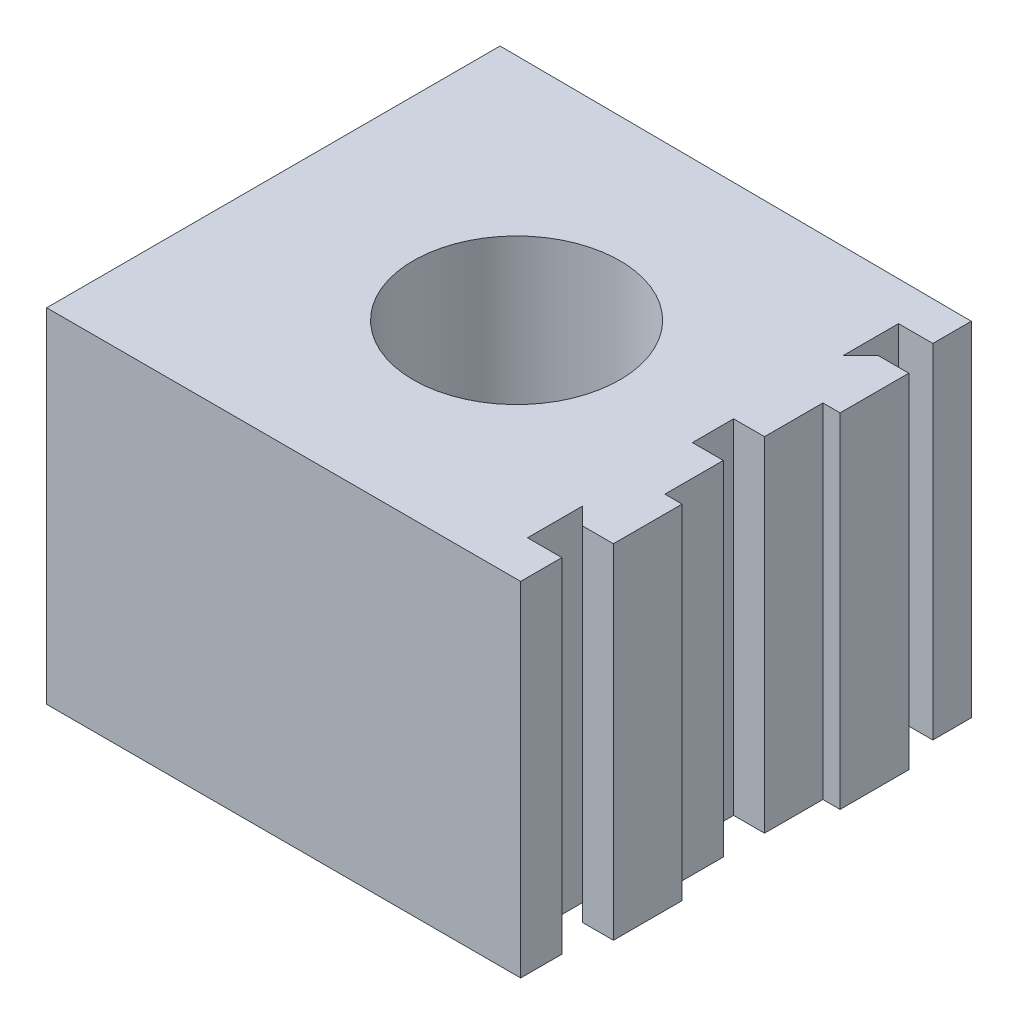
from build123d import *

# Parameters (mm, degrees)
BOSS_EXTRUDE2_DEPTH = 5
CUT_EXTRUDE3_DEPTH  = 7.993900585


with BuildPart() as part:
    # Sketch2 → Boss-Extrude2 (new body)
    with BuildSketch(Plane(origin=(0, 0, 0), x_dir=(1, 0, 0), z_dir=(0, 1, 0))):
        Polygon((3.073930269, -2.114378518), (3.523930269, -2.114378518), (3.523930269, -1.114378518), (3.273930269, -1.114378518), (3.273930269, -0.264378518), (2.823930269, -0.264378518), (2.823930269, 0.335621482), (3.273930269, 0.335621482), (3.273930269, 1.185621482), (3.523930269, 1.185621482), (3.523930269, 2.185621482), (3.073930269, 2.185621482), (2.823930269, 1.935621482), (2.823930269, 2.735621482), (3.323930269, 2.735621482), (3.323930269, 3.295834667), (-3.576069731, 3.335621482), (-3.576069731, -3.264378518), (3.323930269, -3.264378518), (3.323930269, -2.664378518), (2.823930269, -2.664378518), (2.823930269, -1.864378518), align=None)
    extrude(amount=-BOSS_EXTRUDE2_DEPTH)

    # Sketch2<8> → Cut-Extrude3 (cut, through all)
    with BuildSketch(Plane(origin=(0, 0, 0), x_dir=(1, 0, 0), z_dir=(0, 1, 0))):
        with BuildLine():
            ThreePointArc((-1.501831326, -0.001756932), (0.001948854, -1.505537112), (1.505729034, -0.001756932))
            ThreePointArc((1.505729034, -0.001756932), (0.001948854, 1.502023248), (-1.501831326, -0.001756932))
        make_face()
    extrude(amount=-CUT_EXTRUDE3_DEPTH, mode=Mode.SUBTRACT)


solid = part.part
